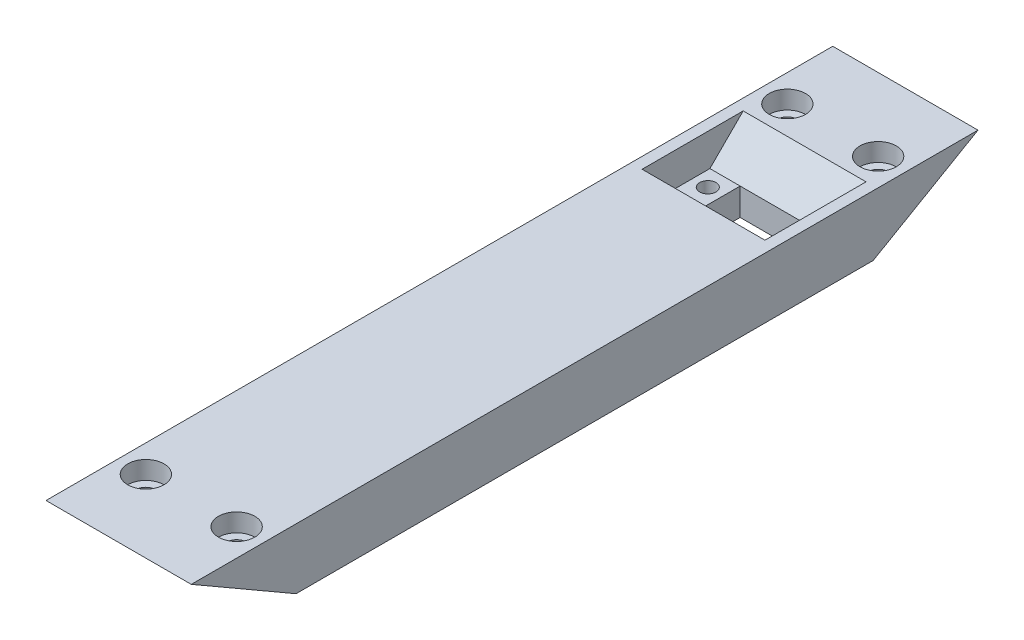
from build123d import *

# Parameters (mm, degrees)
BOSS_EXTRUDE1_DEPTH     = 12
CUT_EXTRUDE1_DEPTH      = 67.850579653
CUT_EXTRUDE1_DEPTH_BACK = 5.5
SKETCH2_W               = 20.3
SKETCH2_H               = 5.7
SKETCH3_W               = 10.3
SKETCH3_H               = 5.7
SKETCH3_R               = 1.35
CUT_EXTRUDE2_DEPTH      = 5.5
CHAMFER1_SIZE           = 5.5
SKETCH4_R               = 1.625
CUT_EXTRUDE3_DEPTH      = 67.850579653
SKETCH5_R               = 3
CUT_EXTRUDE4_DEPTH      = 3


with BuildPart() as part:
    # Sketch1 → Boss-Extrude1 (new, symmetric)
    with BuildSketch(Plane(origin=(0, 0, 0), x_dir=(0, 0, -1), z_dir=(1, 0, 0))):
        Polygon((-65, 0), (65, 0), (47.679491924, -10), (-47.679491924, -10), align=None)
    extrude(amount=BOSS_EXTRUDE1_DEPTH, both=True)

    # Sketch2 → Cut-Extrude1 (cut, two sides: drawn at the far end of the back side and taken through both)
    with BuildSketch(Plane(origin=(0, 0, 0), x_dir=(1, 0, 0), z_dir=(0, 1, 0)).offset(-CUT_EXTRUDE1_DEPTH_BACK)):
        with Locations((0, 40)):
            Rectangle(SKETCH2_W, SKETCH2_H)
    extrude(amount=CUT_EXTRUDE1_DEPTH + CUT_EXTRUDE1_DEPTH_BACK, mode=Mode.SUBTRACT)

    # Sketch3 → Cut-Extrude2 (cut)
    with BuildSketch(Plane(origin=(0, -5.5, 0), x_dir=(1, 0, 0), z_dir=(0, 1, 0))):
        with Locations((0, 40)):
            Rectangle(SKETCH3_W, SKETCH3_H)
        with Locations(Location((-7.65, 40, 0), (0, 0, 270))):
            Circle(SKETCH3_R)
        with Locations(Location((7.65, 40, 0), (0, 0, 270))):
            Circle(SKETCH3_R)
    extrude(amount=-CUT_EXTRUDE2_DEPTH, mode=Mode.SUBTRACT)

    # Chamfer1
    chamfer1_edges = [part.edges().sort_by_distance(p)[0] for p in [
        (0, 0, -37.15),
        (0, 0, -42.85),
    ]]
    chamfer(chamfer1_edges, length=CHAMFER1_SIZE - 0.0001)  # a hair under: the kernel refuses the full size

    # Sketch4 → Cut-Extrude3 (cut, through all)
    with BuildSketch(Plane(origin=(0, 0, 0), x_dir=(1, 0, 0), z_dir=(0, 1, 0))):
        with Locations(Location((-7.5, 53, 0), (0, 0, 270))):
            Circle(SKETCH4_R)
        with Locations(Location((7.5, 53, 0), (0, 0, 270))):
            Circle(SKETCH4_R)
    cut_extrude3 = extrude(amount=-CUT_EXTRUDE3_DEPTH, mode=Mode.SUBTRACT)

    # Sketch5 → Cut-Extrude4 (cut)
    with BuildSketch(Plane(origin=(0, 0, 0), x_dir=(1, 0, 0), z_dir=(0, 1, 0))):
        with Locations(Location((-7.5, 53, 0), (0, 0, 270))):
            Circle(SKETCH5_R)
        with Locations(Location((7.5, 53, 0), (0, 0, 270))):
            Circle(SKETCH5_R)
    cut_extrude4 = extrude(amount=-CUT_EXTRUDE4_DEPTH, mode=Mode.SUBTRACT)

    # Mirror1: Cut-Extrude3, Cut-Extrude4 across plane
    add(cut_extrude3.mirror(Plane.XY), mode=Mode.SUBTRACT)
    add(cut_extrude4.mirror(Plane.XY), mode=Mode.SUBTRACT)


solid = part.part
